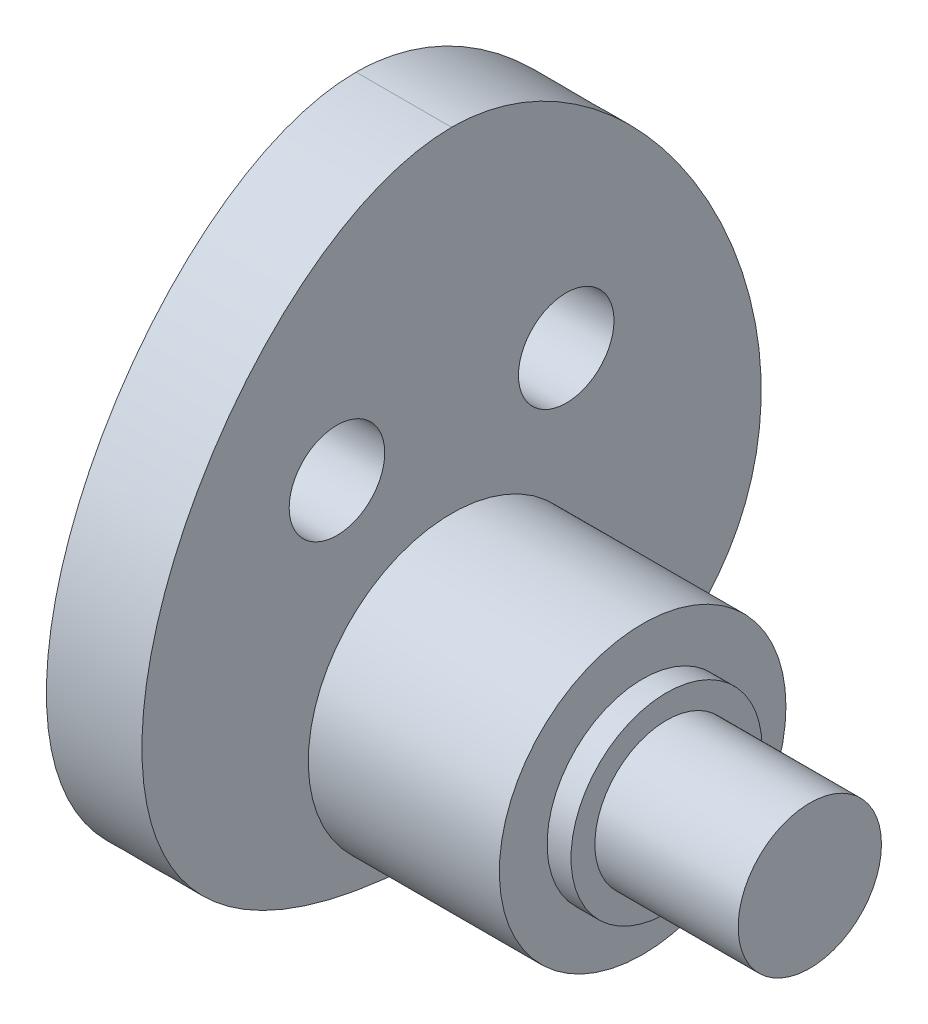
from build123d import *

# Parameters (mm, degrees)
SKETCH1_R           = 2.5
BOSS_EXTRUDE1_DEPTH = 2
SKETCH2_R           = 3
BOSS_EXTRUDE2_DEPTH = 7.5
CUT_EXTRUDE1_REACH  = 17.241
SKETCH3_R           = 1
CHAMFER1_SIZE       = 1
SKETCH4_OUTSIDE_W   = 19.1
SKETCH4_OUTSIDE_H   = 19.134
SKETCH4_OUTSIDE_R   = 1.5
CUT_EXTRUDE2_DEPTH  = 3
SKETCH5_OUTSIDE_W   = 19.1
SKETCH5_OUTSIDE_H   = 19.134
SKETCH5_OUTSIDE_R   = 2
CUT_EXTRUDE3_DEPTH  = 0.5


with BuildPart() as part:
    # Sketch1 → Boss-Extrude1 (new body)
    with BuildSketch(Plane(origin=(0, 0, 0), x_dir=(0, 0, -1), z_dir=(1, 0, 0))):
        with BuildLine():
            add(Edge.make_bspline(
                [(0, 10), (-5.575397586, 10), (-11.256765776, -3), (0, -3)],
                knots=[0, 0, 0, 0, 1, 1, 1, 1], degree=3))
            add(Edge.make_bspline(
                [(0, 10), (5.575397586, 10), (11.256765776, -3), (0, -3)],
                knots=[0, 0, 0, 0, 1, 1, 1, 1], degree=3))
        make_face()
        Circle(SKETCH1_R, mode=Mode.SUBTRACT)
    extrude(amount=BOSS_EXTRUDE1_DEPTH)

    # Sketch2 → Boss-Extrude2 (add)
    with BuildSketch(Plane(origin=(2, 0, 0), x_dir=(0, 0, -1), z_dir=(1, 0, 0))):
        Circle(SKETCH2_R)
    extrude(amount=BOSS_EXTRUDE2_DEPTH)

    # Sketch3 → Cut-Extrude1 (cut, up to next)
    with BuildSketch(Plane.ZY, mode=Mode.PRIVATE) as cut_extrude1_sk1:
        with Locations((-2.4, 4.8)):
            Circle(SKETCH3_R)
    cut_extrude1_tool1 = extrude(cut_extrude1_sk1.sketch, amount=-CUT_EXTRUDE1_REACH, mode=Mode.PRIVATE) & part.part
    # Sketch3 → Cut-Extrude1 (cut, up to next)
    with BuildSketch(Plane.ZY, mode=Mode.PRIVATE) as cut_extrude1_sk2:
        with Locations((2.4, 4.8)):
            Circle(SKETCH3_R)
    cut_extrude1_tool2 = extrude(cut_extrude1_sk2.sketch, amount=-CUT_EXTRUDE1_REACH, mode=Mode.PRIVATE) & part.part
    add(cut_extrude1_tool1.solids().sort_by_distance((0, 4.8, -2.4))[0], mode=Mode.SUBTRACT)
    add(cut_extrude1_tool2.solids().sort_by_distance((0, 4.8, 2.4))[0], mode=Mode.SUBTRACT)

    # Chamfer1
    chamfer1_edges = [part.edges().sort_by_distance(p)[0] for p in [
        (2, 0, 2.5),
    ]]
    chamfer(chamfer1_edges, length=CHAMFER1_SIZE)

    # Sketch4 outside → Cut-Extrude2 (cut)
    with BuildSketch(Plane(origin=(9.5, 0, 0), x_dir=(0, 0, -1), z_dir=(1, 0, 0))):
        with Locations((0, 3.5)):
            Rectangle(SKETCH4_OUTSIDE_W, SKETCH4_OUTSIDE_H)
        Circle(SKETCH4_OUTSIDE_R, mode=Mode.SUBTRACT)
    extrude(amount=-CUT_EXTRUDE2_DEPTH, mode=Mode.SUBTRACT)

    # Sketch5 outside → Cut-Extrude3 (cut)
    with BuildSketch(Plane(origin=(6.5, 0, 0), x_dir=(0, 0, -1), z_dir=(1, 0, 0))):
        with Locations((0, 3.5)):
            Rectangle(SKETCH5_OUTSIDE_W, SKETCH5_OUTSIDE_H)
        Circle(SKETCH5_OUTSIDE_R, mode=Mode.SUBTRACT)
    extrude(amount=-CUT_EXTRUDE3_DEPTH, mode=Mode.SUBTRACT)


solid = part.part
